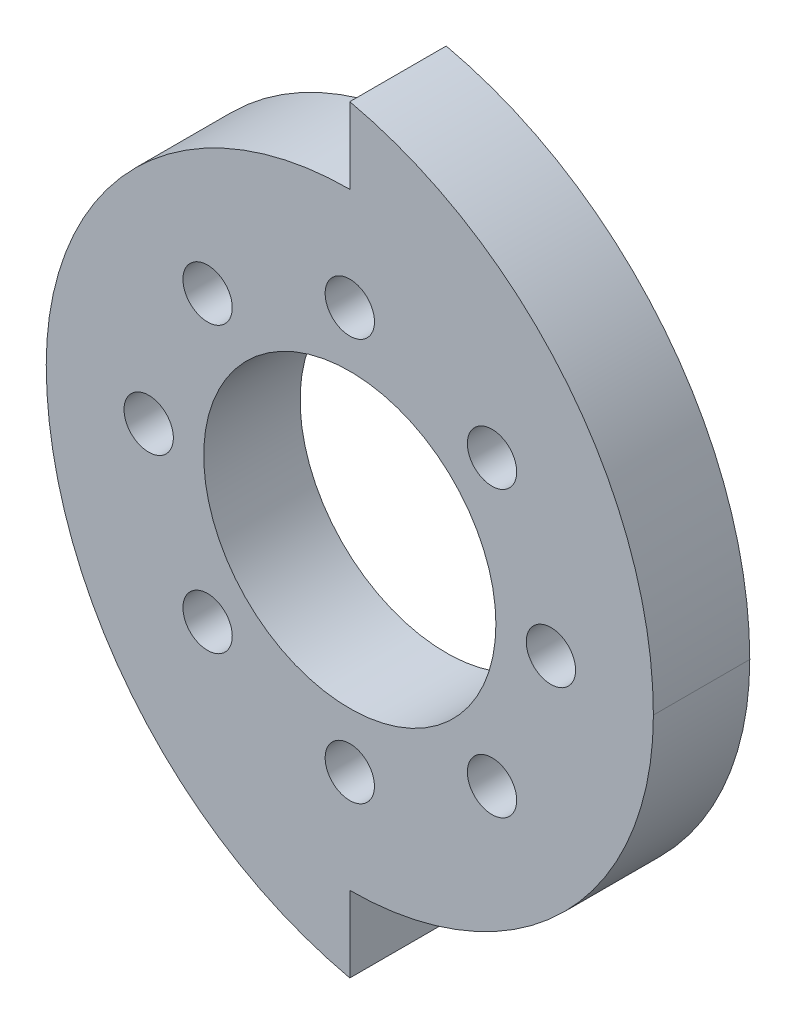
from build123d import *

# Parameters (mm, degrees)
BOSS_EXTRUDE1_DEPTH = 6.35
SKETCH4_R           = 9.625
SKETCH4_R_2         = 1.625
CUT_EXTRUDE1_DEPTH  = 33.639278485
CIRPATTERN1_COUNT   = 8


with BuildPart() as part:
    # Sketch3 → Boss-Extrude1 (new body)
    with BuildSketch(Plane.XY):
        with BuildLine():
            Line((0, 20), (0, 25))
            ThreePointArc((0, 25), (14.384763242, 16.007810594), (20, 0))
            ThreePointArc((20, 0), (14.142135624, -14.142135624), (0, -20))
            Line((0, -20), (0, -25))
            ThreePointArc((0, -25), (-14.384763242, -16.007810594), (-20, 0))
            ThreePointArc((-20, 0), (-14.142135624, 14.142135624), (0, 20))
        make_face()
    extrude(amount=BOSS_EXTRUDE1_DEPTH)

    # Sketch4 → Cut-Extrude1 (cut, through all)
    with BuildSketch(Plane.XY.offset(6.35)):
        Circle(SKETCH4_R)
        with Locations((0, 13.25)):
            Circle(SKETCH4_R_2)
    cut_extrude1 = extrude(amount=-CUT_EXTRUDE1_DEPTH, mode=Mode.SUBTRACT)

    # CirPattern1: Cut-Extrude1 ×8 about axis
    cirpattern1_axis = Axis((0, 0, -0.475), (0, 0, 1))
    for i in range(1, CIRPATTERN1_COUNT):
        add(cut_extrude1.rotate(cirpattern1_axis, i * 360 / CIRPATTERN1_COUNT), mode=Mode.SUBTRACT)


solid = part.part
